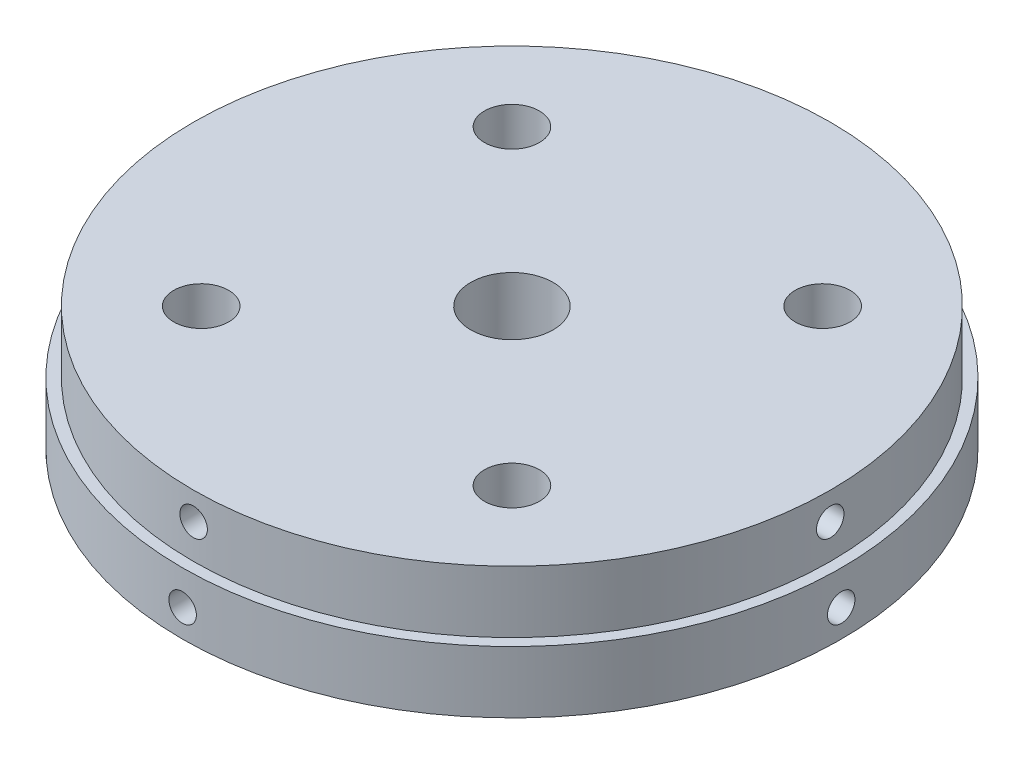
from build123d import *

# Parameters (mm, degrees)
SKETCH1_R           = 76.2
BOSS_EXTRUDE1_DEPTH = 28.575
SKETCH2_R           = 9.525
CUT_EXTRUDE1_DEPTH  = 112.48726665
SKETCH30_R          = 3.175
CUT_EXTRUDE2_DEPTH  = 25.4
CIRPATTERN3_COUNT   = 4
SKETCH31_R          = 6.35
CUT_EXTRUDE3_DEPTH  = 112.487266812
CIRPATTERN4_COUNT   = 4
SKETCH34_W          = 2.54
SKETCH34_H          = 14.2875


with BuildPart() as part:
    # Sketch1 → Boss-Extrude1 (new body)
    with BuildSketch(Plane(origin=(0, 0, 0), x_dir=(1, 0, 0), z_dir=(0, 1, 0))):
        Circle(SKETCH1_R)
    extrude(amount=BOSS_EXTRUDE1_DEPTH)

    # Sketch2 → Cut-Extrude1 (cut, through all)
    with BuildSketch(Plane(origin=(0, 28.575, 0), x_dir=(1, 0, 0), z_dir=(0, 1, 0))):
        Circle(SKETCH2_R)
    extrude(amount=-CUT_EXTRUDE1_DEPTH, mode=Mode.SUBTRACT)

    # Sketch30 → Cut-Extrude2 (cut)
    with BuildSketch(Plane.XY.offset(76.2)):
        with Locations((0, 22.225)):
            Circle(SKETCH30_R)
        with Locations((0, 6.35)):
            Circle(SKETCH30_R)
    cut_extrude2 = extrude(amount=-CUT_EXTRUDE2_DEPTH, mode=Mode.SUBTRACT)

    # CirPattern3: Cut-Extrude2 ×4 about axis
    cirpattern3_axis = Axis((0, 28.575, 0), (0, -1, 0))
    for i in range(1, CIRPATTERN3_COUNT):
        add(cut_extrude2.rotate(cirpattern3_axis, i * 360 / CIRPATTERN3_COUNT), mode=Mode.SUBTRACT)

    # Sketch31 → Cut-Extrude3 (cut, through all)
    with BuildSketch(Plane(origin=(0, 28.575, 0), x_dir=(1, 0, 0), z_dir=(0, 1, 0))):
        with Locations((35.921024484, 35.921024484)):
            Circle(SKETCH31_R)
    cut_extrude3 = extrude(amount=-CUT_EXTRUDE3_DEPTH, mode=Mode.SUBTRACT)

    # CirPattern4: Cut-Extrude3 ×4 about axis
    cirpattern4_axis = Axis((0, 28.575, 0), (0, -1, 0))
    for i in range(1, CIRPATTERN4_COUNT):
        add(cut_extrude3.rotate(cirpattern4_axis, i * 360 / CIRPATTERN4_COUNT), mode=Mode.SUBTRACT)

    # Sketch34 → Cut-Revolve1 (revolve, cut)
    with BuildSketch(Plane.XY):
        with Locations((74.93, 21.43125)):
            Rectangle(SKETCH34_W, SKETCH34_H)
    revolve(axis=Axis((0, 28.575, 0), (0, -1, 0)), mode=Mode.SUBTRACT)


solid = part.part
